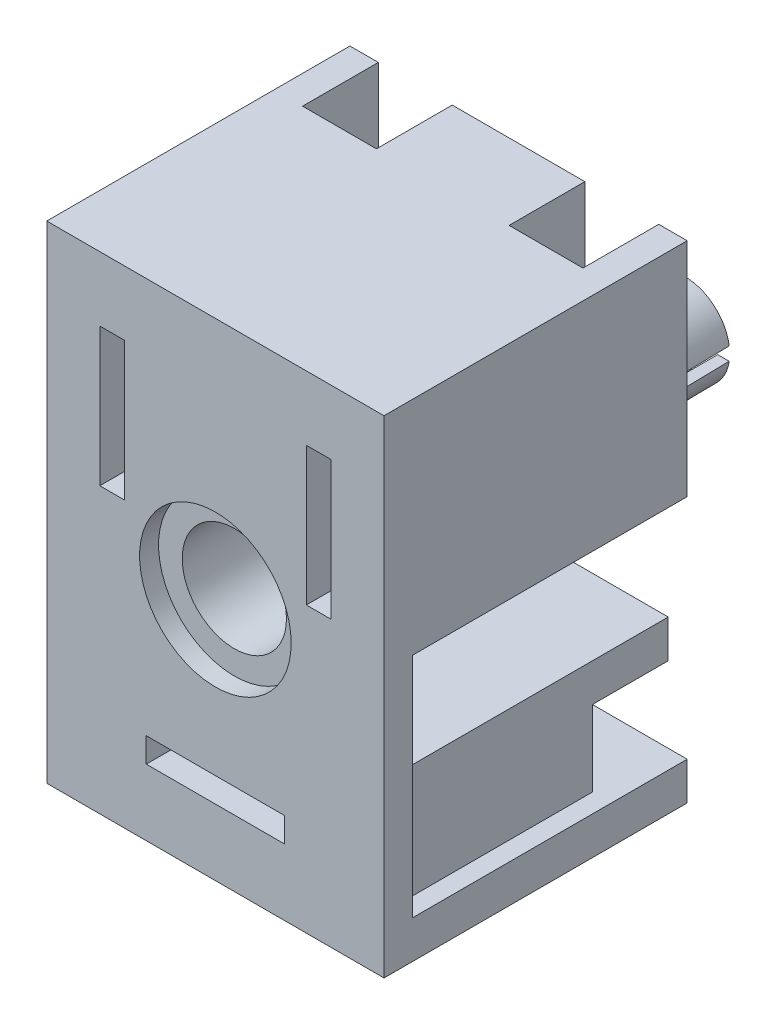
from build123d import *

# Parameters (mm, degrees)
BASES_W                              = 17.8
BASES_H                              = 25.7
BASE_DEPTH                           = 1.5
NEUTRALS_W                           = 1.3
NEUTRALS_H                           = 7.3
NEUTRAL_DEPTH                        = 1.6
FASTENERACCESSS_R                    = 4
FASTENER_ACCESS_DEPTH                = 1
GROUNDS_W                            = 7.3
GROUNDS_H                            = 1.3
GROUND_DEPTH                         = 1.6
BASETOPS_W                           = 17.8
BASETOPS_H                           = 1.5
BASE_TOP_DEPTH                       = 14.5
BASERIGHTWALLS_W                     = 1.5
BASERIGHTWALLS_H                     = 10.2
BASE_RIGHT_WALL_DEPTH                = 14.5
CONNECTORWALLS_W                     = 1.8
CONNECTORWALLS_H                     = 10.2
CONNECTOR_WALL_DEPTH                 = 14.5
CONNECTOR_LOCATE_REACH               = 33.555
CONNECTORLOCATES_W                   = 3.9
CONNECTORLOCATES_H                   = 4
BASEBOTTOMS_W                        = 17.8
BASEBOTTOMS_H                        = 2
BASE_BOTTOM_DEPTH                    = 14.5
FASTENERACCESSHOLEEXTENDS_R          = 2.75
FASTENER_ACCESS_HOLE_EXTEND_DEPTH    = 22.664083179
FASTENER_HOLDING_BODY_DEPTH          = 14.5
FASTENERHOLDINGTOPBORES_R            = 2.75
FASTENER_HOLDING_TOP_BORE_DEPTH      = 8.1
FASTENERHOLDINGBORES_R               = 1.75
FASTENER_HOLDING_BORE_DEPTH          = 19.343731899
ELECTRICALCONNECTIONBASES_W          = 3.9
ELECTRICALCONNECTIONBASES_H          = 1
ELECTRICAL_CONNECTION_BASE_DEPTH     = 14.5
CONNECTIONS_MIDWALL_JOINT_DEPTH      = 14.5
FASTENERHOLDINGEXTENDEDBODYS_R       = 2.5
FASTENERHOLDINGEXTENDEDBODYS_R_2     = 1.75
FASTENER_HOLDING_EXTENDED_BODY_DEPTH = 8.8
FHEB_SLOT_REACH                      = 31.315
FHEB_SLOT_DIRECTION_2_REACH          = 31.315
MIDWALLENDS_W                        = 2.2
MIDWALLENDS_H                        = 1.527350455
MID_WALL_END_DEPTH                   = 14.5
GROUNDWALLS_W                        = 1.5
GROUNDWALLS_H                        = 6
GROUND_WALL_DEPTH                    = 14.5
GROUNDEXTENDEDWALLSS_W               = 10.05
GROUNDEXTENDEDWALLSS_H               = 2
GROUNDEXTENDEDWALLSS_W_2             = 1.5
GROUNDEXTENDEDWALLSS_H_2             = 1.5
GROUND_EXTENDED_WALLS_DEPTH          = 14.5
GROUNDENDWALLS_W                     = 0.85
GROUNDENDWALLS_H                     = 3.5
GROUND_END_WALL_DEPTH                = 14.5
GROUND_CONNECTOR_LOCATE_REACH        = 34.595
GROUNDCONNECTORLOCATES_W             = 4
GROUNDCONNECTORLOCATES_H             = 4


# Read off the part's stored shape, not the designer's step: FHEB DRAFT
with BuildPart() as part:
    # BaseS → BASE (new body)
    with BuildSketch(Plane.XY):
        Rectangle(BASES_W, BASES_H)
    extrude(amount=-BASE_DEPTH)

    # NeutralS → NEUTRAL (cut)
    with BuildSketch(Plane.XY):
        with Locations((5.45, 5.8)):
            Rectangle(NEUTRALS_W, NEUTRALS_H)
    neutral = extrude(amount=-NEUTRAL_DEPTH, mode=Mode.SUBTRACT)

    # LINE HM: NEUTRAL across plane
    add(neutral.mirror(Plane(origin=(0, 0, 0), x_dir=(0, 0, 1), z_dir=(1, 0, 0))), mode=Mode.SUBTRACT)

    # FastenerAccessS → FASTENER ACCESS (cut)
    with BuildSketch(Plane.XY):
        Circle(FASTENERACCESSS_R)
    extrude(amount=-FASTENER_ACCESS_DEPTH, mode=Mode.SUBTRACT)

    # GroundS → GROUND (cut)
    with BuildSketch(Plane.XY):
        with Locations((0, -8.7)):
            Rectangle(GROUNDS_W, GROUNDS_H)
    extrude(amount=-GROUND_DEPTH, mode=Mode.SUBTRACT)

    # BaseTopS → BASE TOP (add)
    with BuildSketch(Plane(origin=(0, 0, -1.5), x_dir=(-1, 0, 0), z_dir=(0, 0, -1))):
        with Locations((0, 12.1)):
            Rectangle(BASETOPS_W, BASETOPS_H)
    extrude(amount=BASE_TOP_DEPTH)

    # BaseRightWallS → BASE RIGHT WALL (add)
    with BuildSketch(Plane(origin=(0, 0, -1.5), x_dir=(-1, 0, 0), z_dir=(0, 0, -1))):
        with Locations((-8.15, 6.25)):
            Rectangle(BASERIGHTWALLS_W, BASERIGHTWALLS_H)
    base_right_wall = extrude(amount=BASE_RIGHT_WALL_DEPTH)

    # ConnectorWallS → CONNECTOR WALL (add)
    with BuildSketch(Plane(origin=(0, 0, -1.5), x_dir=(-1, 0, 0), z_dir=(0, 0, -1))):
        with Locations((-2.6, 6.25)):
            Rectangle(CONNECTORWALLS_W, CONNECTORWALLS_H)
    connector_wall = extrude(amount=CONNECTOR_WALL_DEPTH)

    # ConnectorLocateS → CONNECTOR LOCATE (cut, up to next)
    with BuildSketch(Plane(origin=(0, 12.85, 0), x_dir=(-1, 0, 0), z_dir=(0, 1, 0)), mode=Mode.PRIVATE) as connector_locate_sk1:
        with Locations((-5.45, -14)):
            Rectangle(CONNECTORLOCATES_W, CONNECTORLOCATES_H)
    connector_locate_tool1 = extrude(connector_locate_sk1.sketch, amount=-CONNECTOR_LOCATE_REACH, mode=Mode.PRIVATE) & part.part
    connector_locate = connector_locate_tool1.solids().sort_by_distance((5.45, 12.85, -14))[0]
    add(connector_locate, mode=Mode.SUBTRACT)

    # CW CL HM: BASE RIGHT WALL, CONNECTOR WALL, CONNECTOR LOCATE across plane
    add(base_right_wall.mirror(Plane(origin=(0, 0, 0), x_dir=(0, 0, 1), z_dir=(1, 0, 0))))
    add(connector_wall.mirror(Plane(origin=(0, 0, 0), x_dir=(0, 0, 1), z_dir=(1, 0, 0))))
    add(connector_locate.mirror(Plane(origin=(0, 0, 0), x_dir=(0, 0, 1), z_dir=(1, 0, 0))), mode=Mode.SUBTRACT)

    # BaseBottomS → BASE BOTTOM (add)
    with BuildSketch(Plane(origin=(0, 0, -1.5), x_dir=(-1, 0, 0), z_dir=(0, 0, -1))):
        with Locations((0, -11.85)):
            Rectangle(BASEBOTTOMS_W, BASEBOTTOMS_H)
    extrude(amount=BASE_BOTTOM_DEPTH)

    # FastenerAccessHoleExtendS → FASTENER ACCESS HOLE EXTEND (cut, through all)
    with BuildSketch(Plane.XY.offset(-1)):
        Circle(FASTENERACCESSHOLEEXTENDS_R)
    extrude(amount=-FASTENER_ACCESS_HOLE_EXTEND_DEPTH, mode=Mode.SUBTRACT)

    # FastenerHoldingBodyS → FASTENER HOLDING BODY (add)
    with BuildSketch(Plane(origin=(0, 0, -1.5), x_dir=(-1, 0, 0), z_dir=(0, 0, -1))):
        with BuildLine():
            Line((-3.5, 0), (-3.5, 1.15))
            Line((-3.5, 1.15), (-3.305676935, 1.15))
            ThreePointArc((-3.305676935, 1.15), (0, 3.5), (3.305676935, 1.15))
            Line((3.305676935, 1.15), (3.5, 1.15))
            Line((3.5, 1.15), (3.5, 0))
            ThreePointArc((3.5, 0), (0, -3.5), (-3.5, 0))
        make_face()
    extrude(amount=FASTENER_HOLDING_BODY_DEPTH)

    # FastenerHoldingTopBoreS → FASTENER HOLDING TOP BORE (cut)
    with BuildSketch(Plane.XY.offset(-1.5)):
        Circle(FASTENERHOLDINGTOPBORES_R)
    extrude(amount=-FASTENER_HOLDING_TOP_BORE_DEPTH, mode=Mode.SUBTRACT)

    # FastenerHoldingBoreS → FASTENER HOLDING BORE (cut, through all)
    with BuildSketch(Plane.XY.offset(-9.6)):
        Circle(FASTENERHOLDINGBORES_R)
    extrude(amount=-FASTENER_HOLDING_BORE_DEPTH, mode=Mode.SUBTRACT)

    # ElectricalConnectionBaseS → ELECTRICAL CONNECTION BASE (add)
    with BuildSketch(Plane(origin=(0, 0, -1.5), x_dir=(-1, 0, 0), z_dir=(0, 0, -1))):
        with Locations((-5.45, 1.65)):
            Rectangle(ELECTRICALCONNECTIONBASES_W, ELECTRICALCONNECTIONBASES_H)
        with Locations((5.45, 1.65)):
            Rectangle(ELECTRICALCONNECTIONBASES_W, ELECTRICALCONNECTIONBASES_H)
    extrude(amount=ELECTRICAL_CONNECTION_BASE_DEPTH)

    # ConnectionsMidwallJointS → CONNECTIONS MIDWALL JOINT (add)
    with BuildSketch(Plane(origin=(0, 0, -1.5), x_dir=(-1, 0, 0), z_dir=(0, 0, -1))):
        with BuildLine():
            Line((-1.7, 3.95), (1.7, 3.95))
            Line((1.7, 3.95), (1.7, 3.059411708))
            ThreePointArc((1.7, 3.059411708), (0, 3.5), (-1.7, 3.059411708))
            Line((-1.7, 3.059411708), (-1.7, 3.95))
        make_face()
    extrude(amount=CONNECTIONS_MIDWALL_JOINT_DEPTH)

    # FastenerHoldingExtendedBodyS → FASTENER HOLDING EXTENDED BODY (add)
    with BuildSketch(Plane(origin=(0, 0, -16), x_dir=(-1, 0, 0), z_dir=(0, 0, -1))):
        with Locations(Location((0, 0, 0), (0, 0, 180))):
            Circle(FASTENERHOLDINGEXTENDEDBODYS_R)
        with Locations(Location((0, 0, 0), (0, 0, 180))):
            Circle(FASTENERHOLDINGEXTENDEDBODYS_R_2, mode=Mode.SUBTRACT)
    extrude(amount=FASTENER_HOLDING_EXTENDED_BODY_DEPTH)

    # FHEBSlotS → FHEB SLOT (cut, up to next)
    with BuildSketch(Plane(origin=(0, 0, 0), x_dir=(0, 0, -1), z_dir=(1, 0, 0)), mode=Mode.PRIVATE) as fheb_slot_sk1:
        with BuildLine():
            Line((24.8, -0.35), (19.8, -0.35))
            ThreePointArc((19.8, -0.35), (19.45, 0), (19.8, 0.35))
            Line((19.8, 0.35), (24.8, 0.35))
            Line((24.8, 0.35), (24.8, -0.35))
        make_face()
    fheb_slot_tool1 = extrude(fheb_slot_sk1.sketch, amount=-FHEB_SLOT_REACH, mode=Mode.PRIVATE) & part.part
    add(fheb_slot_tool1.solids().sort_by_distance((0, 0, -22.161977))[0], mode=Mode.SUBTRACT)

    # FHEBSlotS → FHEB SLOT direction 2 (cut, up to next)
    with BuildSketch(Plane(origin=(0, 0, 0), x_dir=(0, 0, -1), z_dir=(1, 0, 0)), mode=Mode.PRIVATE) as fheb_slot_direction_2_sk1:
        with BuildLine():
            Line((24.8, -0.35), (19.8, -0.35))
            ThreePointArc((19.8, -0.35), (19.45, 0), (19.8, 0.35))
            Line((19.8, 0.35), (24.8, 0.35))
            Line((24.8, 0.35), (24.8, -0.35))
        make_face()
    fheb_slot_direction_2_tool1 = extrude(fheb_slot_direction_2_sk1.sketch, amount=FHEB_SLOT_DIRECTION_2_REACH, mode=Mode.PRIVATE) & part.part
    add(fheb_slot_direction_2_tool1.solids().sort_by_distance((0, 0, -22.161977))[0], mode=Mode.SUBTRACT)

    # MidWallEndS → MID WALL END (add)
    with BuildSketch(Plane(origin=(0, 0, -1.5), x_dir=(-1, 0, 0), z_dir=(0, 0, -1))):
        with Locations((0, -4.086324773)):
            Rectangle(MIDWALLENDS_W, MIDWALLENDS_H)
    extrude(amount=MID_WALL_END_DEPTH)

    # GroundWallS → GROUND WALL (add)
    with BuildSketch(Plane(origin=(0, 0, -1.5), x_dir=(-1, 0, 0), z_dir=(0, 0, -1))):
        with Locations((-7.15, -7.85)):
            Rectangle(GROUNDWALLS_W, GROUNDWALLS_H)
    extrude(amount=GROUND_WALL_DEPTH)

    # GroundExtendedWallsS → GROUND EXTENDED WALLS (add)
    with BuildSketch(Plane(origin=(0, 0, -1.5), x_dir=(-1, 0, 0), z_dir=(0, 0, -1))):
        with Locations((-1.375, -5.85)):
            Rectangle(GROUNDEXTENDEDWALLSS_W, GROUNDEXTENDEDWALLSS_H)
        with Locations((2.9, -10.1)):
            Rectangle(GROUNDEXTENDEDWALLSS_W_2, GROUNDEXTENDEDWALLSS_H_2)
    extrude(amount=GROUND_EXTENDED_WALLS_DEPTH)

    # GroundEndWallS → GROUND END WALL (add)
    with BuildSketch(Plane(origin=(0, 0, -1.5), x_dir=(-1, 0, 0), z_dir=(0, 0, -1))):
        with Locations((4.075, -8.1)):
            Rectangle(GROUNDENDWALLS_W, GROUNDENDWALLS_H)
    extrude(amount=GROUND_END_WALL_DEPTH)

    # FHEB DRAFT outline → FHEB DRAFT (revolve, cut)
    with BuildSketch(Plane.XZ):
        Polygon((2.5, -16), (2.346395429, -24.8), (2.5, -24.8), align=None)
    revolve(axis=Axis((0, 0, 0), (0, 0, 1)), mode=Mode.SUBTRACT)

    # GroundConnectorLocateS → GROUND CONNECTOR LOCATE (cut, up to next)
    with BuildSketch(Plane(origin=(7.9, 0, 0), x_dir=(0, 0, -1), z_dir=(1, 0, 0)), mode=Mode.PRIVATE) as ground_connector_locate_sk1:
        with Locations((14, -8.85)):
            Rectangle(GROUNDCONNECTORLOCATES_W, GROUNDCONNECTORLOCATES_H)
    ground_connector_locate_tool1 = extrude(ground_connector_locate_sk1.sketch, amount=-GROUND_CONNECTOR_LOCATE_REACH, mode=Mode.PRIVATE) & part.part
    add(ground_connector_locate_tool1.solids().sort_by_distance((7.9, -8.85, -14))[0], mode=Mode.SUBTRACT)


solid = part.part
